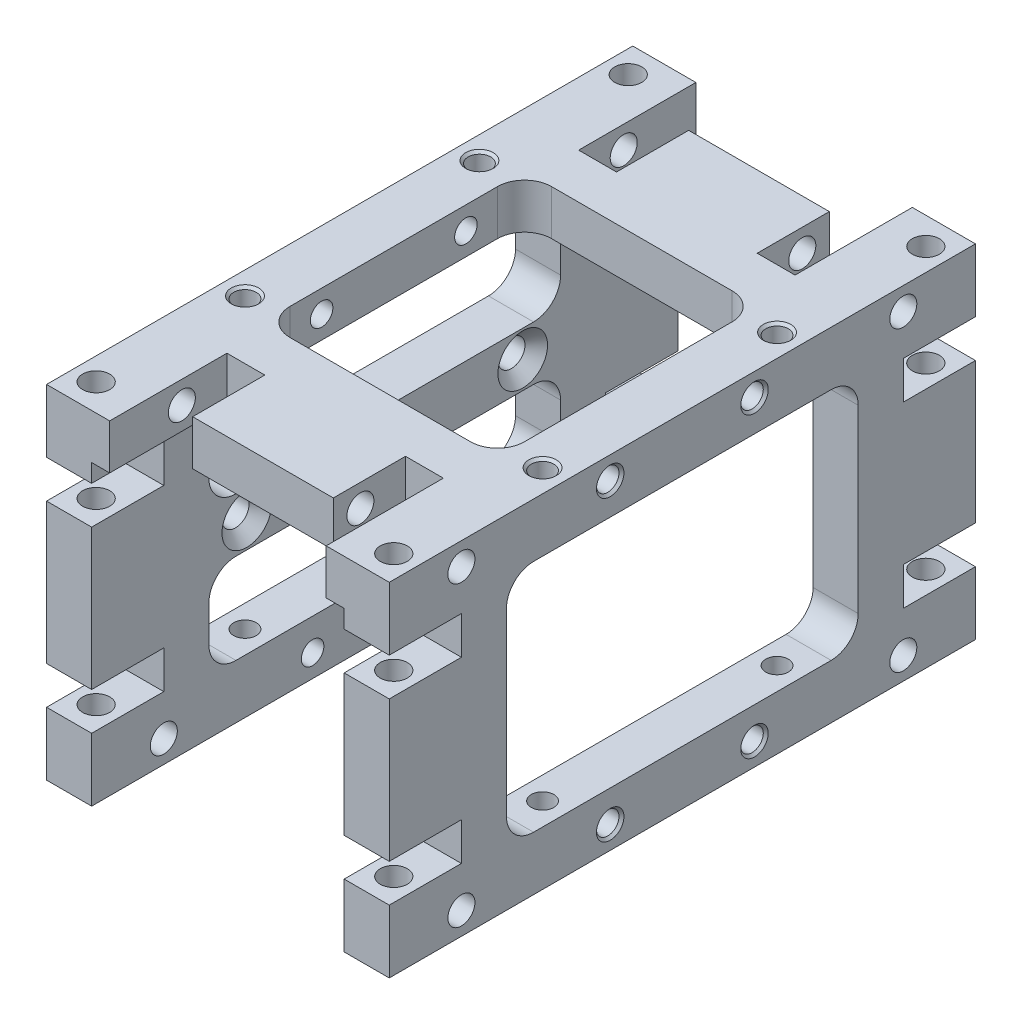
from build123d import *

# Parameters (mm, degrees)
EXTRUDE_1_DEPTH                = 65
SKETCH_2_R                     = 1.5
SKETCH_2_R_2                   = 1.25
SKETCH_2_W                     = 8
SKETCH_2_H                     = 4.2
SKETCH_2_W_2                   = 39
SKETCH_2_H_2                   = 26
CUT_EXTRUDE_1_DEPTH            = 78.653074633
SKETCH_3_R                     = 1.5
SKETCH_3_R_2                   = 1.25
SKETCH_3_W                     = 26
SKETCH_3_H                     = 29
CUT_EXTRUDE_2_DEPTH            = 60
SKETCH_5_W                     = 39
SKETCH_5_H                     = 6
SKETCH_5_R                     = 1.5
EXTRUDE_2_DEPTH                = 5
FILLET_1_R                     = 3
HOLE_WIZARD_M3_1_9_D           = 3
HOLE_WIZARD_M3_1_9_CSINK_D     = 5.5
HOLE_WIZARD_M3_1_9_CSINK_ANGLE = 90


# Read off the part's stored shape, not the designer's step: M3 螺纹孔1
with BuildPart() as part:
    # 草图1 → 凸台-拉伸1 (new body)
    with BuildSketch(Plane.XY):
        Polygon((-14, -19), (-14, 14), (14, 14), (14, -19), (19, -19), (19, 19), (-19, 19), (-19, -19), align=None)
    extrude(amount=EXTRUDE_1_DEPTH)

    # 草图2 → 切除-拉伸1 (cut, through all)
    with BuildSketch(Plane.ZY.offset(19)):
        with Locations(Location((57, -16.5, 0), (0, 0, 270))):
            Circle(SKETCH_2_R)
        with Locations(Location((57, 16.5, 0), (0, 0, 270))):
            Circle(SKETCH_2_R)
        with Locations(Location((8, -16.5, 0), (0, 0, 90))):
            Circle(SKETCH_2_R)
        with Locations(Location((8, 16.5, 0), (0, 0, 90))):
            Circle(SKETCH_2_R)
        with Locations(Location((40.5, -16.5, 0), (0, 0, 270))):
            Circle(SKETCH_2_R_2)
        with Locations(Location((24.5, -16.5, 0), (0, 0, 270))):
            Circle(SKETCH_2_R_2)
        with Locations(Location((24.5, 16.5, 0), (0, 0, 90))):
            Circle(SKETCH_2_R_2)
        with Locations(Location((40.5, 16.5, 0), (0, 0, 90))):
            Circle(SKETCH_2_R_2)
        with Locations((61, 9.9)):
            Rectangle(SKETCH_2_W, SKETCH_2_H)
        with Locations((61, -9.9)):
            Rectangle(SKETCH_2_W, SKETCH_2_H)
        with Locations((4, -9.9)):
            Rectangle(SKETCH_2_W, SKETCH_2_H)
        with Locations((4, 9.9)):
            Rectangle(SKETCH_2_W, SKETCH_2_H)
        with Locations((32.5, 0)):
            Rectangle(SKETCH_2_W_2, SKETCH_2_H_2)
    extrude(amount=-CUT_EXTRUDE_1_DEPTH, mode=Mode.SUBTRACT)

    # 草图3 → 切除-拉伸2 (cut)
    with BuildSketch(Plane(origin=(0, 19, 0), x_dir=(1, 0, 0), z_dir=(0, 1, 0))):
        with Locations(Location((16.5, -62, 0), (0, 0, 270))):
            Circle(SKETCH_3_R)
        with Locations(Location((-16.5, -62, 0), (0, 0, 270))):
            Circle(SKETCH_3_R)
        with Locations(Location((-16.5, -3, 0), (0, 0, 270))):
            Circle(SKETCH_3_R)
        with Locations(Location((16.5, -3, 0), (0, 0, 180))):
            Circle(SKETCH_3_R)
        with Locations(Location((16.5, -45.5, 0), (0, 0, 270))):
            Circle(SKETCH_3_R_2)
        with Locations(Location((16.5, -19.5, 0), (0, 0, 270))):
            Circle(SKETCH_3_R_2)
        with Locations(Location((-16.5, -19.5, 0), (0, 0, 270))):
            Circle(SKETCH_3_R_2)
        with Locations(Location((-16.5, -45.5, 0), (0, 0, 180))):
            Circle(SKETCH_3_R_2)
        Polygon((7.8, -65), (-7.8, -65), (-12, -65), (-12, -52), (-7.8, -52), (-7.8, -60), (7.8, -60), (7.8, -52), (12, -52), (12, -65), align=None)
        Polygon((-12, 0), (-12, -13), (-7.8, -13), (-7.8, -5), (7.8, -5), (7.8, -13), (12, -13), (12, 0), (7.8, 0), (-7.8, 0), align=None)
        with Locations((0, -32.5)):
            Rectangle(SKETCH_3_W, SKETCH_3_H)
    extrude(amount=-CUT_EXTRUDE_2_DEPTH, mode=Mode.SUBTRACT)

    # Hole Wizard M3 _1 outline → Hole Wizard M3 _1 (revolve, cut)
    with BuildSketch(Plane(origin=(0, 16.5, 24.5), x_dir=(0, 1, 0), z_dir=(0, 0, -1))):
        Polygon((1.25, 19), (1.25, 18.725), (1.525, 19), align=None)
        Polygon((1.525, -19), (1.25, -18.725), (1.25, -19), align=None)
    revolve(axis=Axis((0, 16.5, 24.5), (1, 0, 0)), mode=Mode.SUBTRACT)

    # Hole Wizard M3 _1 2 outline → Hole Wizard M3 _1 2 (revolve, cut)
    with BuildSketch(Plane(origin=(0, 16.5, 40.5), x_dir=(0, 1, 0), z_dir=(0, 0, -1))):
        Polygon((1.25, 19), (1.25, 18.725), (1.525, 19), align=None)
        Polygon((1.525, -19), (1.25, -18.725), (1.25, -19), align=None)
    revolve(axis=Axis((0, 16.5, 40.5), (1, 0, 0)), mode=Mode.SUBTRACT)

    # Hole Wizard M3 _1 3 outline → Hole Wizard M3 _1 3 (revolve, cut)
    with BuildSketch(Plane(origin=(0, -16.5, 40.5), x_dir=(0, 1, 0), z_dir=(0, 0, -1))):
        Polygon((1.25, 19), (1.25, 18.725), (1.525, 19), align=None)
        Polygon((1.525, -19), (1.25, -18.725), (1.25, -19), align=None)
    revolve(axis=Axis((0, -16.5, 40.5), (1, 0, 0)), mode=Mode.SUBTRACT)

    # Hole Wizard M3 _1 4 outline → Hole Wizard M3 _1 4 (revolve, cut)
    with BuildSketch(Plane(origin=(0, -16.5, 24.5), x_dir=(0, 1, 0), z_dir=(0, 0, -1))):
        Polygon((1.25, 19), (1.25, 18.725), (1.525, 19), align=None)
        Polygon((1.525, -19), (1.25, -18.725), (1.25, -19), align=None)
    revolve(axis=Axis((0, -16.5, 24.5), (1, 0, 0)), mode=Mode.SUBTRACT)

    # Hole Wizard M3 _1 5 outline → Hole Wizard M3 _1 5 (revolve, cut)
    with BuildSketch(Plane(origin=(16.5, 0, 45.5), x_dir=(1, 0, 0), z_dir=(0, 0, 1))):
        Polygon((1.525, -19), (1.25, -18.725), (1.25, -19), align=None)
        Polygon((1.25, 19), (1.25, 18.725), (1.525, 19), align=None)
    revolve(axis=Axis((16.5, 0, 45.5), (0, 1, 0)), mode=Mode.SUBTRACT)

    # Hole Wizard M3 _1 6 outline → Hole Wizard M3 _1 6 (revolve, cut)
    with BuildSketch(Plane(origin=(-16.5, 0, 19.5), x_dir=(1, 0, 0), z_dir=(0, 0, 1))):
        Polygon((1.525, -19), (1.25, -18.725), (1.25, -19), align=None)
        Polygon((1.25, 19), (1.25, 18.725), (1.525, 19), align=None)
    revolve(axis=Axis((-16.5, 0, 19.5), (0, 1, 0)), mode=Mode.SUBTRACT)

    # Hole Wizard M3 _1 7 outline → Hole Wizard M3 _1 7 (revolve, cut)
    with BuildSketch(Plane(origin=(-16.5, 0, 45.5), x_dir=(1, 0, 0), z_dir=(0, 0, 1))):
        Polygon((1.525, -19), (1.25, -18.725), (1.25, -19), align=None)
        Polygon((1.25, 19), (1.25, 18.725), (1.525, 19), align=None)
    revolve(axis=Axis((-16.5, 0, 45.5), (0, 1, 0)), mode=Mode.SUBTRACT)

    # Hole Wizard M3 _1 8 outline → Hole Wizard M3 _1 8 (revolve, cut)
    with BuildSketch(Plane(origin=(16.5, 0, 19.5), x_dir=(1, 0, 0), z_dir=(0, 0, 1))):
        Polygon((1.525, -19), (1.25, -18.725), (1.25, -19), align=None)
        Polygon((1.25, 19), (1.25, 18.725), (1.525, 19), align=None)
    revolve(axis=Axis((16.5, 0, 19.5), (0, 1, 0)), mode=Mode.SUBTRACT)

    # 草图5 → 凸台-拉伸2 (add)
    with BuildSketch(Plane.ZY.offset(19)):
        with Locations((32.5, 0)):
            Rectangle(SKETCH_5_W, SKETCH_5_H)
        with Locations((17.2, 0)):
            Circle(SKETCH_5_R, mode=Mode.SUBTRACT)
        with Locations((47.8, 0)):
            Circle(SKETCH_5_R, mode=Mode.SUBTRACT)
    extrude(amount=-EXTRUDE_2_DEPTH)

    # 圆角1
    fillet_1_edges = [part.edges().sort_by_distance(p)[0] for p in [
        (13, 16.5, 47),
        (-13, 16.5, 18),
        (13, 16.5, 18),
        (-13, 16.5, 47),
        (-16.5, -3, 52),
        (-16.5, 3, 52),
        (-16.5, 3, 13),
        (-16.5, -3, 13),
        (-16.5, 13, 52),
        (16.5, 13, 52),
        (-16.5, -13, 52),
        (16.5, -13, 52),
        (-16.5, -13, 13),
        (16.5, -13, 13),
        (-16.5, 13, 13),
        (16.5, 13, 13),
    ]]
    fillet(fillet_1_edges, radius=FILLET_1_R)

    # Hole Wizard M3 _1 9 (through all)
    with Locations(Plane(origin=(-14, 0, 47.8), x_dir=(0, 1, 0), z_dir=(1, 0, 0))):
        with Locations((0, 0), (0, -30.6)):
            CounterSinkHole(HOLE_WIZARD_M3_1_9_D / 2, HOLE_WIZARD_M3_1_9_CSINK_D / 2, counter_sink_angle=HOLE_WIZARD_M3_1_9_CSINK_ANGLE)


solid = part.part
